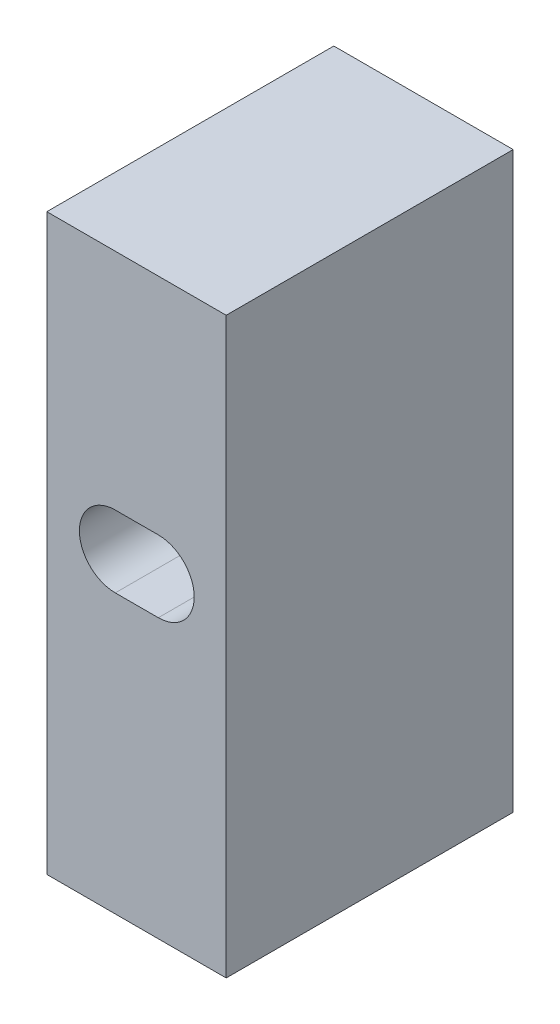
from build123d import *

# Parameters (mm, degrees)
SKETCH1_W                           = 15.875
SKETCH1_H                           = 25.4
BOSS_EXTRUDE1_DEPTH                 = 50.8
TAP_DRILL_FOR_10_24_TAP1_D          = 3.7973
TAP_DRILL_FOR_10_24_TAP1_DEPTH      = 20.701
TAP_DRILL_FOR_10_24_TAP1_TIP        = 1.140824014
TAP_START                           = -25.4
TAP_DRILL_SLOT_FOR_10_24_TAP1_DEPTH = 25.4


# Read off the part's stored shape, not the designer's step: Tap Drill Slot for #10-24 Tap1
with BuildPart() as part:
    # Sketch1 → Boss-Extrude1 (new body)
    with BuildSketch(Plane(origin=(0, 0, 0), x_dir=(1, 0, 0), z_dir=(0, 1, 0))):
        with Locations((7.9375, 12.7)):
            Rectangle(SKETCH1_W, SKETCH1_H)
    extrude(amount=BOSS_EXTRUDE1_DEPTH)

    # Tap Drill for #10-24 Tap1
    with Locations(Plane(origin=(0, 0, 0), x_dir=(-1, 0, 0), z_dir=(0, -1, 0))):
        with Locations((-7.9375, 6), (-7.9375, 19.4)):
            Hole(TAP_DRILL_FOR_10_24_TAP1_D / 2, depth=TAP_DRILL_FOR_10_24_TAP1_DEPTH)
            with Locations((0, 0, -(TAP_DRILL_FOR_10_24_TAP1_DEPTH + TAP_DRILL_FOR_10_24_TAP1_TIP / 2))):  # 118° drill point
                Cone(0, TAP_DRILL_FOR_10_24_TAP1_D / 2, TAP_DRILL_FOR_10_24_TAP1_TIP, mode=Mode.SUBTRACT)

    # Tap Drill Slot for #10-24 Tap1 outline → Tap Drill Slot for #10-24 Tap1 (cut)
    with BuildSketch(Plane.XY.offset(TAP_START)):
        with BuildLine():
            Line((6.058801855, 24.6126), (9.868801855, 24.6126))
            ThreePointArc((9.868801855, 24.6126), (13.043801855, 27.7876), (9.868801855, 30.9626))
            Line((9.868801855, 30.9626), (6.058801855, 30.9626))
            ThreePointArc((6.058801855, 30.9626), (2.883801855, 27.7876), (6.058801855, 24.6126))
        make_face()
    extrude(amount=TAP_DRILL_SLOT_FOR_10_24_TAP1_DEPTH, mode=Mode.SUBTRACT)


solid = part.part
